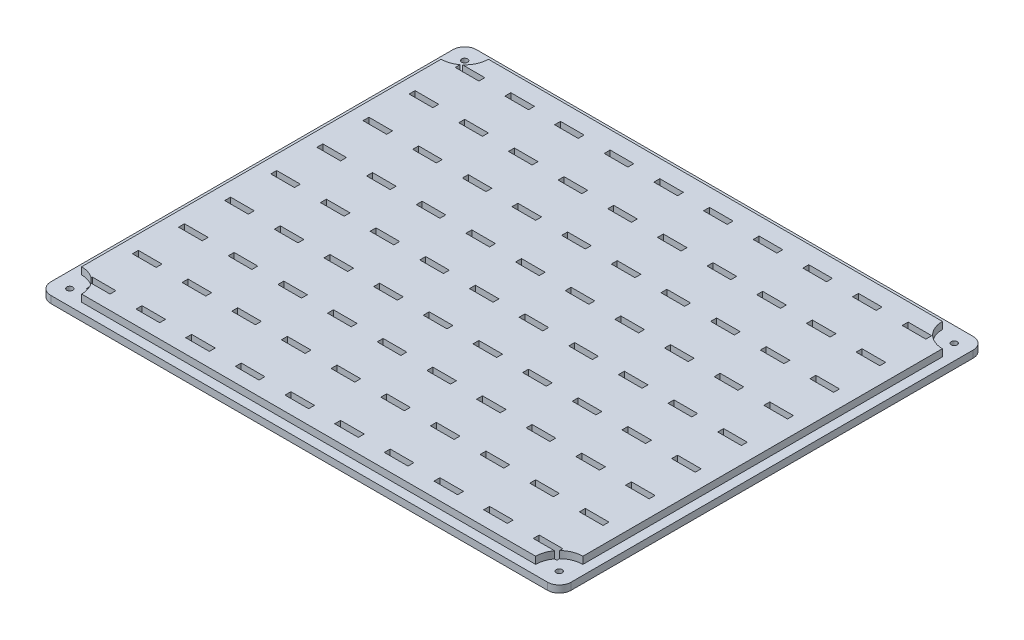
from build123d import *

# Parameters (mm, degrees)
SKETCH1_W           = 220
SKETCH1_H           = 180
BOSS_EXTRUDE1_DEPTH = 3
FILLET1_R           = 5
BOSS_EXTRUDE2_DEPTH = 3
SKETCH8_R           = 1.25
CUT_EXTRUDE3_DEPTH  = 285.269238575
SKETCH9_W           = 10
SKETCH9_H           = 2.5
CUT_EXTRUDE4_DEPTH  = 285.316724798


with BuildPart() as part:
    # Sketch1 → Boss-Extrude1 (new body)
    with BuildSketch(Plane(origin=(0, 0, 0), x_dir=(1, 0, 0), z_dir=(0, 1, 0))):
        with Locations((110, 90)):
            Rectangle(SKETCH1_W, SKETCH1_H)
    extrude(amount=BOSS_EXTRUDE1_DEPTH)

    # Fillet1
    fillet1_edges = [part.edges().sort_by_distance(p)[0] for p in [
        (0, 1.5, -180),
        (0, 1.5, 0),
        (220, 1.5, -180),
        (220, 1.5, 0),
    ]]
    fillet(fillet1_edges, radius=FILLET1_R)

    # Sketch7 → Boss-Extrude2 (add)
    with BuildSketch(Plane(origin=(0, 3, 0), x_dir=(1, 0, 0), z_dir=(0, 1, 0))):
        with BuildLine():
            Line((206, 176), (14, 176))
            ThreePointArc((14, 176), (11.071067812, 168.928932188), (4, 166))
            Line((4, 166), (4, 14))
            ThreePointArc((4, 14), (11.071067812, 11.071067812), (14, 4))
            Line((14, 4), (206, 4))
            ThreePointArc((206, 4), (208.928932188, 11.071067812), (216, 14))
            Line((216, 14), (216, 166))
            ThreePointArc((216, 166), (208.928932188, 168.928932188), (206, 176))
        make_face()
    extrude(amount=BOSS_EXTRUDE2_DEPTH)

    # Sketch8 → Cut-Extrude3 (cut, through all)
    with BuildSketch(Plane(origin=(0, 3, 0), x_dir=(1, 0, 0), z_dir=(0, 1, 0))):
        with Locations((6.5, 173.5)):
            Circle(SKETCH8_R)
        with Locations((213.5, 173.5)):
            Circle(SKETCH8_R)
        with Locations((213.5, 6.5)):
            Circle(SKETCH8_R)
        with Locations((6.5, 6.5)):
            Circle(SKETCH8_R)
    extrude(amount=-CUT_EXTRUDE3_DEPTH, mode=Mode.SUBTRACT)

    # Sketch9 → Cut-Extrude4 (cut, through all)
    with BuildSketch(Plane.XZ):
        with Locations((36, -11.25)):
            Rectangle(SKETCH9_W, SKETCH9_H)
        with Locations((15, -11.25)):
            Rectangle(SKETCH9_W, SKETCH9_H)
        with Locations((57, -11.25)):
            Rectangle(SKETCH9_W, SKETCH9_H)
        with Locations((78, -11.25)):
            Rectangle(SKETCH9_W, SKETCH9_H)
        with Locations((99, -11.25)):
            Rectangle(SKETCH9_W, SKETCH9_H)
        with Locations((120, -11.25)):
            Rectangle(SKETCH9_W, SKETCH9_H)
        with Locations((141, -11.25)):
            Rectangle(SKETCH9_W, SKETCH9_H)
        with Locations((162, -11.25)):
            Rectangle(SKETCH9_W, SKETCH9_H)
        with Locations((183, -11.25)):
            Rectangle(SKETCH9_W, SKETCH9_H)
        with Locations((204, -11.25)):
            Rectangle(SKETCH9_W, SKETCH9_H)
        with Locations((36, -30.75)):
            Rectangle(SKETCH9_W, SKETCH9_H)
        with Locations((57, -30.75)):
            Rectangle(SKETCH9_W, SKETCH9_H)
        with Locations((78, -30.75)):
            Rectangle(SKETCH9_W, SKETCH9_H)
        with Locations((99, -30.75)):
            Rectangle(SKETCH9_W, SKETCH9_H)
        with Locations((120, -30.75)):
            Rectangle(SKETCH9_W, SKETCH9_H)
        with Locations((141, -30.75)):
            Rectangle(SKETCH9_W, SKETCH9_H)
        with Locations((162, -30.75)):
            Rectangle(SKETCH9_W, SKETCH9_H)
        with Locations((183, -30.75)):
            Rectangle(SKETCH9_W, SKETCH9_H)
        with Locations((204, -30.75)):
            Rectangle(SKETCH9_W, SKETCH9_H)
        with Locations((36, -50.25)):
            Rectangle(SKETCH9_W, SKETCH9_H)
        with Locations((57, -50.25)):
            Rectangle(SKETCH9_W, SKETCH9_H)
        with Locations((78, -50.25)):
            Rectangle(SKETCH9_W, SKETCH9_H)
        with Locations((99, -50.25)):
            Rectangle(SKETCH9_W, SKETCH9_H)
        with Locations((120, -50.25)):
            Rectangle(SKETCH9_W, SKETCH9_H)
        with Locations((141, -50.25)):
            Rectangle(SKETCH9_W, SKETCH9_H)
        with Locations((162, -50.25)):
            Rectangle(SKETCH9_W, SKETCH9_H)
        with Locations((183, -50.25)):
            Rectangle(SKETCH9_W, SKETCH9_H)
        with Locations((204, -50.25)):
            Rectangle(SKETCH9_W, SKETCH9_H)
        with Locations((36, -69.75)):
            Rectangle(SKETCH9_W, SKETCH9_H)
        with Locations((57, -69.75)):
            Rectangle(SKETCH9_W, SKETCH9_H)
        with Locations((78, -69.75)):
            Rectangle(SKETCH9_W, SKETCH9_H)
        with Locations((99, -69.75)):
            Rectangle(SKETCH9_W, SKETCH9_H)
        with Locations((120, -69.75)):
            Rectangle(SKETCH9_W, SKETCH9_H)
        with Locations((141, -69.75)):
            Rectangle(SKETCH9_W, SKETCH9_H)
        with Locations((162, -69.75)):
            Rectangle(SKETCH9_W, SKETCH9_H)
        with Locations((183, -69.75)):
            Rectangle(SKETCH9_W, SKETCH9_H)
        with Locations((204, -69.75)):
            Rectangle(SKETCH9_W, SKETCH9_H)
        with Locations((36, -89.25)):
            Rectangle(SKETCH9_W, SKETCH9_H)
        with Locations((57, -89.25)):
            Rectangle(SKETCH9_W, SKETCH9_H)
        with Locations((78, -89.25)):
            Rectangle(SKETCH9_W, SKETCH9_H)
        with Locations((99, -89.25)):
            Rectangle(SKETCH9_W, SKETCH9_H)
        with Locations((120, -89.25)):
            Rectangle(SKETCH9_W, SKETCH9_H)
        with Locations((141, -89.25)):
            Rectangle(SKETCH9_W, SKETCH9_H)
        with Locations((162, -89.25)):
            Rectangle(SKETCH9_W, SKETCH9_H)
        with Locations((183, -89.25)):
            Rectangle(SKETCH9_W, SKETCH9_H)
        with Locations((204, -89.25)):
            Rectangle(SKETCH9_W, SKETCH9_H)
        with Locations((36, -108.75)):
            Rectangle(SKETCH9_W, SKETCH9_H)
        with Locations((57, -108.75)):
            Rectangle(SKETCH9_W, SKETCH9_H)
        with Locations((78, -108.75)):
            Rectangle(SKETCH9_W, SKETCH9_H)
        with Locations((99, -108.75)):
            Rectangle(SKETCH9_W, SKETCH9_H)
        with Locations((120, -108.75)):
            Rectangle(SKETCH9_W, SKETCH9_H)
        with Locations((141, -108.75)):
            Rectangle(SKETCH9_W, SKETCH9_H)
        with Locations((162, -108.75)):
            Rectangle(SKETCH9_W, SKETCH9_H)
        with Locations((183, -108.75)):
            Rectangle(SKETCH9_W, SKETCH9_H)
        with Locations((204, -108.75)):
            Rectangle(SKETCH9_W, SKETCH9_H)
        with Locations((36, -128.25)):
            Rectangle(SKETCH9_W, SKETCH9_H)
        with Locations((57, -128.25)):
            Rectangle(SKETCH9_W, SKETCH9_H)
        with Locations((78, -128.25)):
            Rectangle(SKETCH9_W, SKETCH9_H)
        with Locations((99, -128.25)):
            Rectangle(SKETCH9_W, SKETCH9_H)
        with Locations((120, -128.25)):
            Rectangle(SKETCH9_W, SKETCH9_H)
        with Locations((141, -128.25)):
            Rectangle(SKETCH9_W, SKETCH9_H)
        with Locations((162, -128.25)):
            Rectangle(SKETCH9_W, SKETCH9_H)
        with Locations((183, -128.25)):
            Rectangle(SKETCH9_W, SKETCH9_H)
        with Locations((204, -128.25)):
            Rectangle(SKETCH9_W, SKETCH9_H)
        with Locations((36, -147.75)):
            Rectangle(SKETCH9_W, SKETCH9_H)
        with Locations((57, -147.75)):
            Rectangle(SKETCH9_W, SKETCH9_H)
        with Locations((78, -147.75)):
            Rectangle(SKETCH9_W, SKETCH9_H)
        with Locations((99, -147.75)):
            Rectangle(SKETCH9_W, SKETCH9_H)
        with Locations((120, -147.75)):
            Rectangle(SKETCH9_W, SKETCH9_H)
        with Locations((141, -147.75)):
            Rectangle(SKETCH9_W, SKETCH9_H)
        with Locations((162, -147.75)):
            Rectangle(SKETCH9_W, SKETCH9_H)
        with Locations((183, -147.75)):
            Rectangle(SKETCH9_W, SKETCH9_H)
        with Locations((204, -147.75)):
            Rectangle(SKETCH9_W, SKETCH9_H)
        with Locations((36, -167.25)):
            Rectangle(SKETCH9_W, SKETCH9_H)
        with Locations((57, -167.25)):
            Rectangle(SKETCH9_W, SKETCH9_H)
        with Locations((78, -167.25)):
            Rectangle(SKETCH9_W, SKETCH9_H)
        with Locations((99, -167.25)):
            Rectangle(SKETCH9_W, SKETCH9_H)
        with Locations((120, -167.25)):
            Rectangle(SKETCH9_W, SKETCH9_H)
        with Locations((141, -167.25)):
            Rectangle(SKETCH9_W, SKETCH9_H)
        with Locations((162, -167.25)):
            Rectangle(SKETCH9_W, SKETCH9_H)
        with Locations((183, -167.25)):
            Rectangle(SKETCH9_W, SKETCH9_H)
        with Locations((204, -167.25)):
            Rectangle(SKETCH9_W, SKETCH9_H)
        with Locations((15, -30.75)):
            Rectangle(SKETCH9_W, SKETCH9_H)
        with Locations((15, -50.25)):
            Rectangle(SKETCH9_W, SKETCH9_H)
        with Locations((15, -69.75)):
            Rectangle(SKETCH9_W, SKETCH9_H)
        with Locations((15, -89.25)):
            Rectangle(SKETCH9_W, SKETCH9_H)
        with Locations((15, -108.75)):
            Rectangle(SKETCH9_W, SKETCH9_H)
        with Locations((15, -128.25)):
            Rectangle(SKETCH9_W, SKETCH9_H)
        with Locations((15, -147.75)):
            Rectangle(SKETCH9_W, SKETCH9_H)
        with Locations((15, -167.25)):
            Rectangle(SKETCH9_W, SKETCH9_H)
    extrude(amount=-CUT_EXTRUDE4_DEPTH, mode=Mode.SUBTRACT)


solid = part.part
